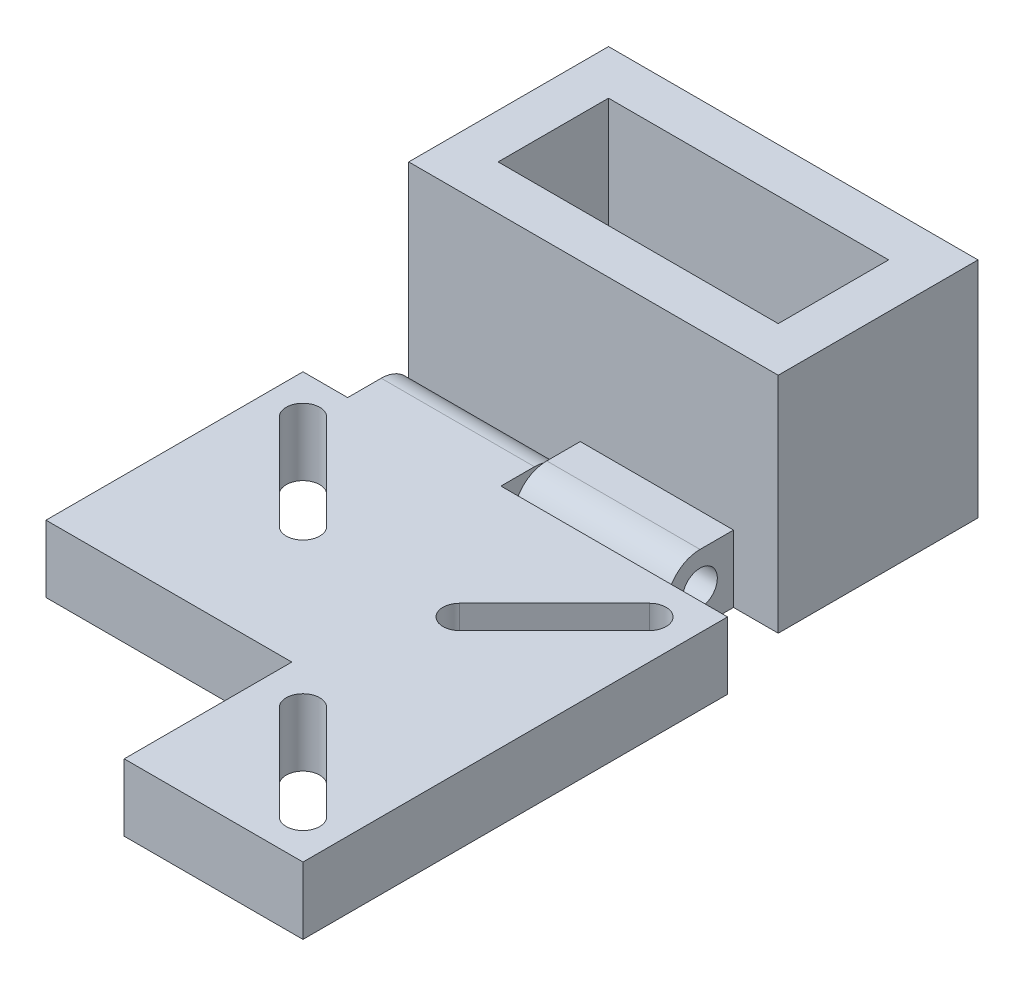
from build123d import *

# Parameters (mm, degrees)
SKETCH1_W             = 25.07
SKETCH1_H             = 9.88
BOSS_EXTRUDE1_DEPTH   = 6
BOSS_EXTRUDE1_2_DEPTH = 6
SKETCH1_3_W           = 33.07
SKETCH1_3_H           = 17.88
SKETCH1_3_W_2         = 25.07
SKETCH1_3_H_2         = 9.88
BOSS_EXTRUDE2_DEPTH   = 20
FILLET1_R             = 3
FILLET2_R             = 3
SKETCH2_R             = 1.55
CUT_EXTRUDE1_DEPTH    = 13.7175
SKETCH4_R             = 1.55
CUT_EXTRUDE2_DEPTH    = 13.7175
CUT_EXTRUDE3_DEPTH    = 6


with BuildPart() as part:
    # Sketch1 → Boss-Extrude1 (new body)
    with BuildSketch(Plane(origin=(0, 0, 0), x_dir=(1, 0, 0), z_dir=(0, 1, 0))):
        Polygon((16.535, -8.94), (16.535, 8.94), (-16.535, 8.94), (-16.535, -8.94), (-1.1825, -8.94), (-1.1825, -14.94), (12.535, -14.94), (12.535, -8.94), align=None)
        Rectangle(SKETCH1_W, SKETCH1_H, mode=Mode.SUBTRACT)
    extrude(amount=BOSS_EXTRUDE1_DEPTH)

    # Sketch1<3> → Boss-Extrude2 (add)
    with BuildSketch(Plane(origin=(0, 0, 0), x_dir=(1, 0, 0), z_dir=(0, 1, 0))):
        Rectangle(SKETCH1_3_W, SKETCH1_3_H)
        Rectangle(SKETCH1_3_W_2, SKETCH1_3_H_2, mode=Mode.SUBTRACT)
    extrude(amount=BOSS_EXTRUDE2_DEPTH)

    # Fillet1
    fillet1_edges = [part.edges().sort_by_distance(p)[0] for p in [
        (5.67625, 0, 14.94),
        (5.67625, 6, 14.94),
    ]]
    fillet(fillet1_edges, radius=FILLET1_R - 0.0001)  # a hair under: the kernel refuses the full size

    # Sketch2 → Cut-Extrude1 (cut)
    with BuildSketch(Plane(origin=(12.535, 0, 0), x_dir=(0, 0, -1), z_dir=(1, 0, 0))):
        with Locations((-11.94, 3)):
            Circle(SKETCH2_R)
    extrude(amount=-CUT_EXTRUDE1_DEPTH, mode=Mode.SUBTRACT)


with BuildPart() as body_2:
    # Sketch1 → Boss-Extrude1 2 (new body)
    with BuildSketch(Plane(origin=(0, 0, 0), x_dir=(1, 0, 0), z_dir=(0, 1, 0))):
        Polygon((-1.2825, -15.94), (-1.2825, -9.94), (-15, -9.94), (-15, -15.94), (-19, -15.94), (-19, -38.94), (3, -38.94), (3, -53.94), (19, -53.94), (19, -15.94), align=None)
    extrude(amount=BOSS_EXTRUDE1_2_DEPTH)

    # Fillet2
    fillet2_edges = [body_2.edges().sort_by_distance(p)[0] for p in [
        (-8.14125, 0, 9.94),
        (-8.14125, 6, 9.94),
    ]]
    fillet(fillet2_edges, radius=FILLET2_R - 0.0001)  # a hair under: the kernel refuses the full size

    # Sketch4 → Cut-Extrude2 (cut)
    with BuildSketch(Plane.ZY.offset(15)):
        with Locations((12.94, 3)):
            Circle(SKETCH4_R)
    extrude(amount=-CUT_EXTRUDE2_DEPTH, mode=Mode.SUBTRACT)

    # Sketch5 → Cut-Extrude3 (cut)
    with BuildSketch(Plane.XZ):
        with BuildLine():
            Line((-16.560660172, 20.500660172), (-8.075378798, 28.985941546))
            ThreePointArc((-8.075378798, 28.985941546), (-5.954058454, 28.985941546), (-5.954058454, 26.864621202))
            Line((-5.954058454, 26.864621202), (-14.439339828, 18.379339828))
            ThreePointArc((-14.439339828, 18.379339828), (-16.560660172, 18.379339828), (-16.560660172, 20.500660172))
        make_face()
        with BuildLine():
            Line((16.560660172, 49.379339828), (8.075378798, 40.894058454))
            ThreePointArc((8.075378798, 40.894058454), (5.954058454, 40.894058454), (5.954058454, 43.015378798))
            Line((5.954058454, 43.015378798), (14.439339828, 51.500660172))
            ThreePointArc((14.439339828, 51.500660172), (16.560660172, 51.500660172), (16.560660172, 49.379339828))
        make_face()
        with BuildLine():
            Line((14.439339828, 18.379339828), (5.954058454, 26.864621202))
            ThreePointArc((5.954058454, 26.864621202), (5.954058454, 28.985941546), (8.075378798, 28.985941546))
            Line((8.075378798, 28.985941546), (16.560660172, 20.500660172))
            ThreePointArc((16.560660172, 20.500660172), (16.560660172, 18.379339828), (14.439339828, 18.379339828))
        make_face()
    extrude(amount=-CUT_EXTRUDE3_DEPTH, mode=Mode.SUBTRACT)


solid = Compound([part.part, body_2.part])
